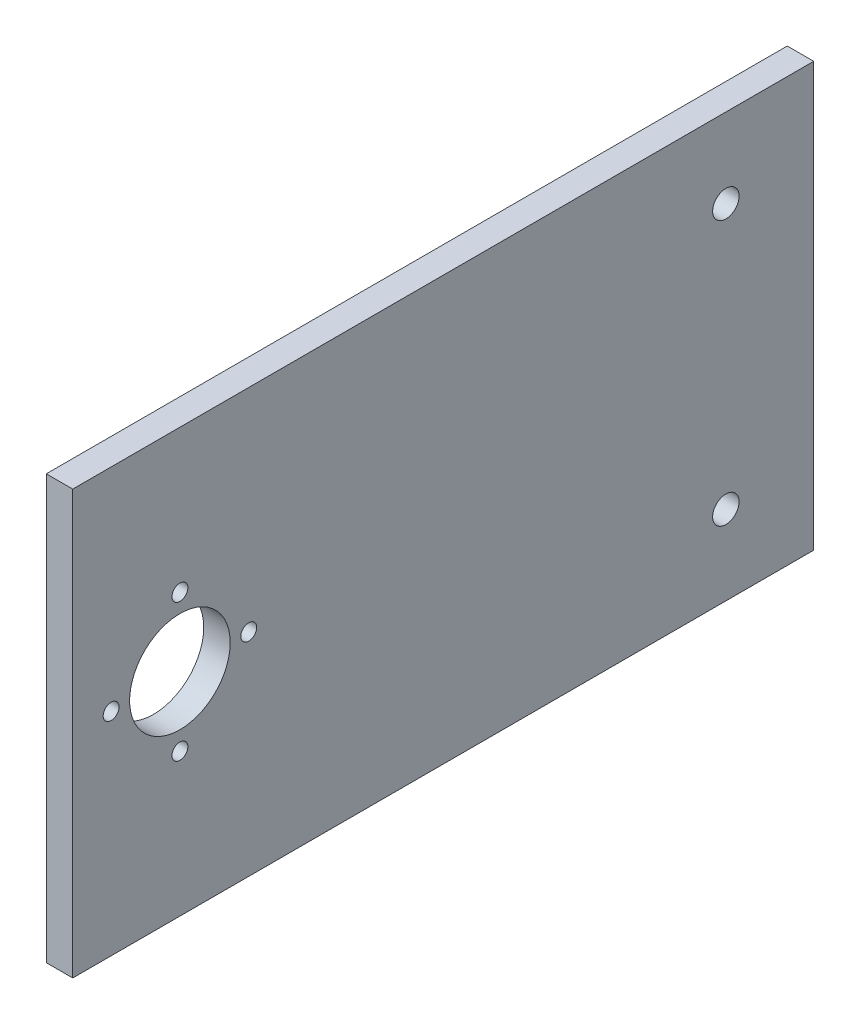
from build123d import *

# Parameters (mm, degrees)
SKETCH1_W           = 80
SKETCH1_H           = 140
SKETCH1_R           = 1.5
SKETCH1_R_2         = 9.5
SKETCH1_R_3         = 2.5
BOSS_EXTRUDE1_DEPTH = 5


with BuildPart() as part:
    # Sketch1 → Boss-Extrude1 (new body)
    with BuildSketch(Plane.YZ):
        Rectangle(SKETCH1_W, SKETCH1_H)
        with Locations((0, 62.75)):
            Circle(SKETCH1_R, mode=Mode.SUBTRACT)
        with Locations((0, 36.75)):
            Circle(SKETCH1_R, mode=Mode.SUBTRACT)
        with Locations((-13, 49.75)):
            Circle(SKETCH1_R, mode=Mode.SUBTRACT)
        with Locations((13, 49.75)):
            Circle(SKETCH1_R, mode=Mode.SUBTRACT)
        with Locations((0, 49.75)):
            Circle(SKETCH1_R_2, mode=Mode.SUBTRACT)
        with Locations((-25, -53.4)):
            Circle(SKETCH1_R_3, mode=Mode.SUBTRACT)
        with Locations((25, -53.4)):
            Circle(SKETCH1_R_3, mode=Mode.SUBTRACT)
    extrude(amount=BOSS_EXTRUDE1_DEPTH)


solid = part.part
